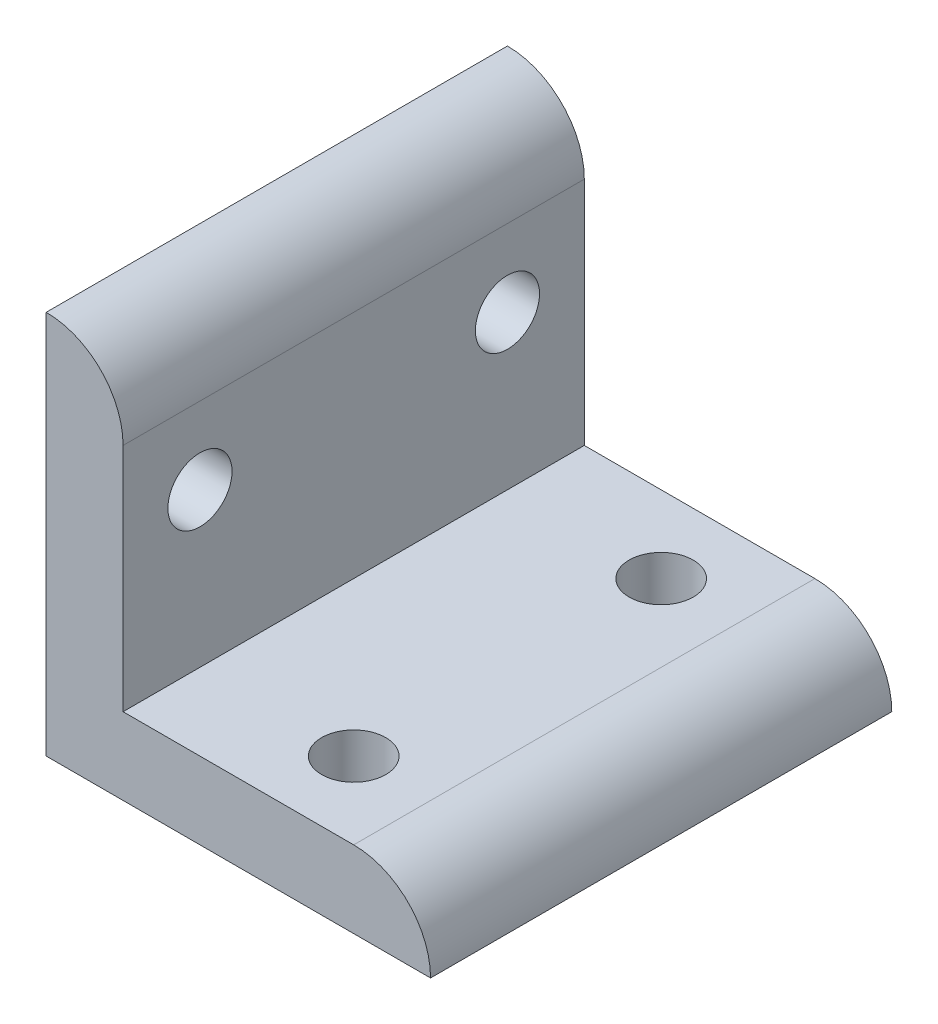
from build123d import *

# Parameters (mm, degrees)
BOSS_EXTRUDE1_DEPTH  = 38.1
FILLET1_R            = 6.35
M5_CLEARANCE_HOLE1_D = 5.3


with BuildPart() as part:
    # Sketch1 → Boss-Extrude1 (new body)
    with BuildSketch(Plane.XY):
        Polygon((0, 0), (31.75, 0), (31.75, 6.35), (6.35, 6.35), (6.35, 31.75), (0, 31.75), align=None)
    extrude(amount=BOSS_EXTRUDE1_DEPTH)

    # Fillet1
    fillet1_edges = [part.edges().sort_by_distance(p)[0] for p in [
        (31.75, 6.35, 19.05),
        (6.35, 31.75, 19.05),
    ]]
    fillet(fillet1_edges, radius=FILLET1_R - 0.0001)  # a hair under: the kernel refuses the full size

    # M5 Clearance Hole1 (through all)
    with Locations(Plane(origin=(6.35, 0, 0), x_dir=(0, 0, -1), z_dir=(1, 0, 0))):
        with Locations((-31.75, 19.05), (-6.35, 19.05)):
            m5_clearance_hole1 = Hole(M5_CLEARANCE_HOLE1_D / 2)

    # Mirror1: M5 Clearance Hole1 across plane
    add(m5_clearance_hole1.mirror(Plane(origin=(0, 0, 0), x_dir=(0, 0, 1), z_dir=(-0.7071067811865472, 0.7071067811865479, 0))), mode=Mode.SUBTRACT)


solid = part.part
